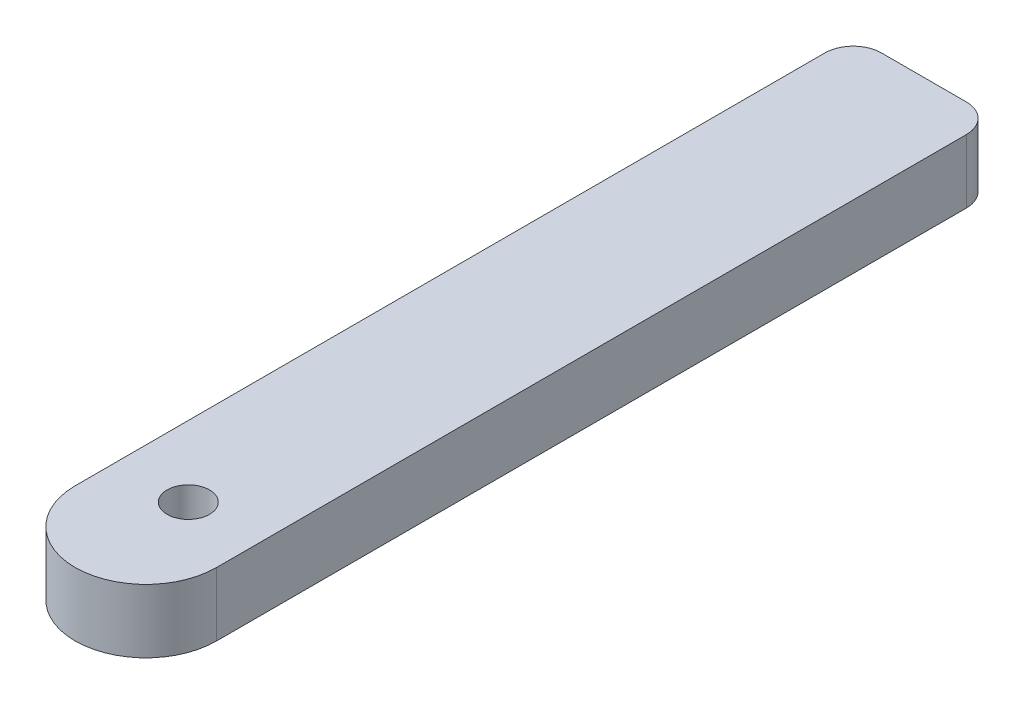
from build123d import *

# Parameters (mm, degrees)
ESQUISSE1_R        = 1.5
BOSS_EXTRU_1_DEPTH = 4.5
CONG_1_R           = 2


with BuildPart() as part:
    # Esquisse1 → Boss.-Extru.1 (new body)
    with BuildSketch(Plane(origin=(0, 0, 0), x_dir=(1, 0, 0), z_dir=(0, 1, 0))):
        with BuildLine():
            Line((5, 40), (-5, 40))
            Line((-5, 40), (-5, -15))
            ThreePointArc((-5, -15), (0, -20), (5, -15))
            Line((5, -15), (5, 40))
        make_face()
        with Locations((0, -12)):
            Circle(ESQUISSE1_R, mode=Mode.SUBTRACT)
    extrude(amount=BOSS_EXTRU_1_DEPTH)

    # Congé1
    cong_1_edges = [part.edges().sort_by_distance(p)[0] for p in [
        (-5, 2.25, -40),
        (5, 2.25, -40),
    ]]
    fillet(cong_1_edges, radius=CONG_1_R)


solid = part.part
